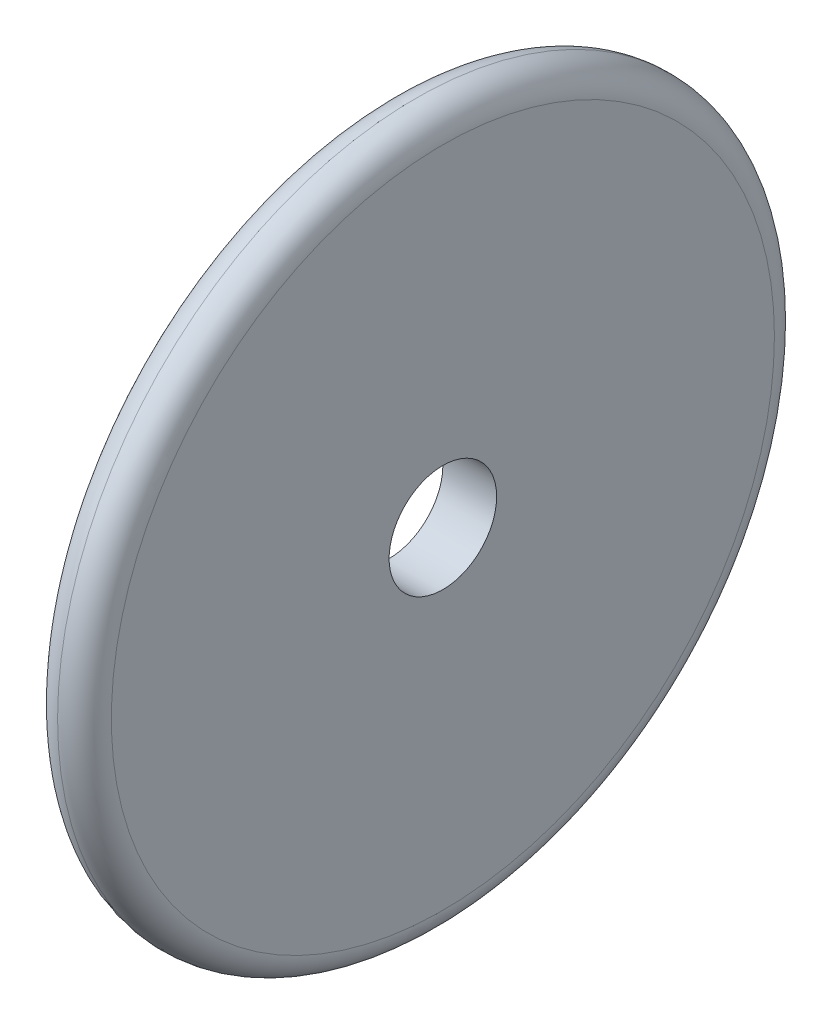
from build123d import *

# Parameters (mm, degrees)
SKETCH1_R           = 10
SKETCH1_R_2         = 1.5
BOSS_EXTRUDE1_DEPTH = 1.5
FILLET1_R           = 0.75


with BuildPart() as part:
    # Sketch1 → Boss-Extrude1 (new body)
    with BuildSketch(Plane.YZ):
        with Locations(Location((0, 0, 0), (0, 0, 270))):
            Circle(SKETCH1_R)
        with Locations(Location((0, 0, 0), (0, 0, 270))):
            Circle(SKETCH1_R_2, mode=Mode.SUBTRACT)
    extrude(amount=BOSS_EXTRUDE1_DEPTH)

    # Fillet1
    fillet1_edges = [part.edges().sort_by_distance(p)[0] for p in [
        (0, 0, 10),
        (1.5, 0, 10),
    ]]
    fillet(fillet1_edges, radius=FILLET1_R - 0.0001)  # a hair under: the kernel refuses the full size


solid = part.part
